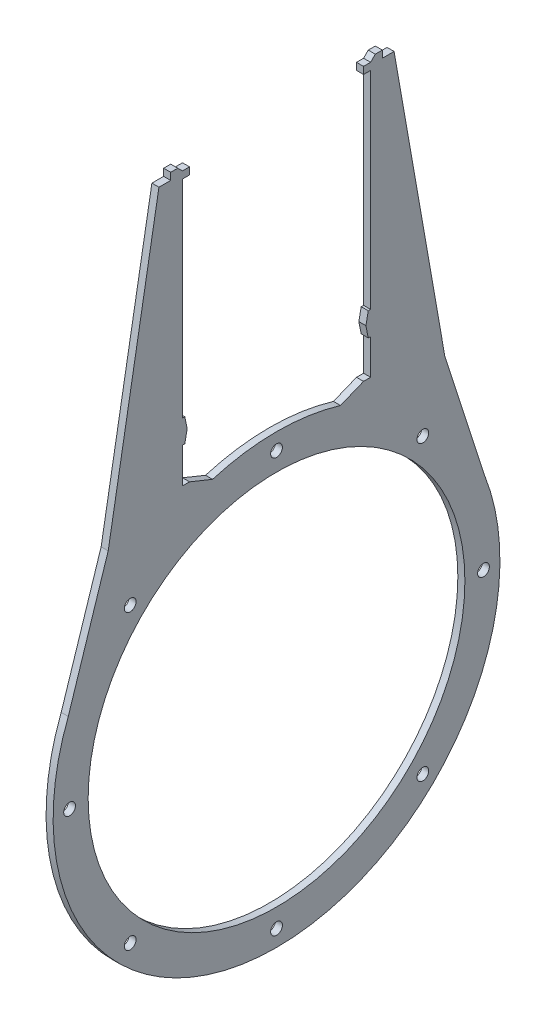
from build123d import *

# Parameters (mm, degrees)
SZKIC1_R                    = 80.1
SZKIC1_R_2                  = 2.5
DODANIE_WYCI_GNI_CIE1_DEPTH = 3


with BuildPart() as part:
    # Szkic1 → Dodanie-wyciągnięcie1 (new body)
    with BuildSketch(Plane(origin=(0, 0, 0), x_dir=(0, 0, -1), z_dir=(1, 0, 0))):
        with BuildLine():
            Line((351.558988424, 167.812336449), (351.558988424, 79.812336449))
            Line((351.558988424, 79.812336449), (350.558988424, 79.812336449))
            Line((350.558988424, 79.812336449), (349.558988424, 74.812336449))
            Line((349.558988424, 74.812336449), (350.558988424, 69.812336449))
            Line((350.558988424, 69.812336449), (351.558988424, 69.812336449))
            Line((351.558988424, 69.812336449), (351.558988424, 54.812336449))
            Line((351.558988424, 54.812336449), (348.558988424, 54.812336449))
            Line((348.558988424, 54.812336449), (338.753063174, 50.836961347))
            ThreePointArc((338.753063174, 50.836961347), (311.558988424, 54.812336656), (284.364913674, 50.836961347))
            Line((284.364913674, 50.836961347), (274.558988424, 54.812336449))
            Line((274.558988424, 54.812336449), (271.558988424, 54.812336449))
            Line((271.558988424, 54.812336449), (271.558988424, 69.812336449))
            Line((271.558988424, 69.812336449), (272.558988424, 69.812336449))
            Line((272.558988424, 69.812336449), (273.558988424, 74.812336449))
            Line((273.558988424, 74.812336449), (272.558988424, 79.812336449))
            Line((272.558988424, 79.812336449), (271.558988424, 79.812336449))
            Line((271.558988424, 79.812336449), (271.558988424, 167.812336449))
            Line((271.558988424, 167.812336449), (274.558988424, 167.812336449))
            Line((274.558988424, 167.812336449), (274.558988424, 170.812336449))
            Line((274.558988424, 170.812336449), (271.558988424, 170.812336449))
            Line((271.558988424, 170.812336449), (269.558988424, 172.812336449))
            Line((269.558988424, 172.812336449), (266.558988424, 172.812336449))
            Line((266.558988424, 172.812336449), (266.558988424, 169.812336449))
            Line((266.558988424, 169.812336449), (261.558988424, 169.812336449))
            Line((261.558988424, 169.812336449), (239.976630351, 46.682582513))
            Line((239.976630351, 46.682582513), (222.998790471, -5.806107769))
            ThreePointArc((222.998790471, -5.806107769), (311.558988424, -135.187663758), (400.119186377, -5.806107769))
            Line((400.119186377, -5.806107769), (383.141346497, 46.682582513))
            Line((383.141346497, 46.682582513), (361.558988424, 169.812336449))
            Line((361.558988424, 169.812336449), (356.558988424, 169.812336449))
            Line((356.558988424, 169.812336449), (356.558988424, 172.812336449))
            Line((356.558988424, 172.812336449), (353.558988424, 172.812336449))
            Line((353.558988424, 172.812336449), (351.558988424, 170.812336449))
            Line((351.558988424, 170.812336449), (348.558988424, 170.812336449))
            Line((348.558988424, 170.812336449), (348.558988424, 167.812336449))
            Line((348.558988424, 167.812336449), (351.558988424, 167.812336449))
        make_face()
        with Locations((311.558988424, -40.187663551)):
            Circle(SZKIC1_R, mode=Mode.SUBTRACT)
        with Locations((311.558988424, 47.812336449)):
            Circle(SZKIC1_R_2, mode=Mode.SUBTRACT)
        with Locations((249.33359168, 22.037733193)):
            Circle(SZKIC1_R_2, mode=Mode.SUBTRACT)
        with Locations((249.33359168, -102.413060295)):
            Circle(SZKIC1_R_2, mode=Mode.SUBTRACT)
        with Locations((311.558988424, -128.187663551)):
            Circle(SZKIC1_R_2, mode=Mode.SUBTRACT)
        with Locations((373.784385168, -102.413060295)):
            Circle(SZKIC1_R_2, mode=Mode.SUBTRACT)
        with Locations((399.558988424, -40.187663551)):
            Circle(SZKIC1_R_2, mode=Mode.SUBTRACT)
        with Locations((373.784385168, 22.037733193)):
            Circle(SZKIC1_R_2, mode=Mode.SUBTRACT)
        with Locations((223.558988424, -40.187663551)):
            Circle(SZKIC1_R_2, mode=Mode.SUBTRACT)
    extrude(amount=DODANIE_WYCI_GNI_CIE1_DEPTH)


solid = part.part
